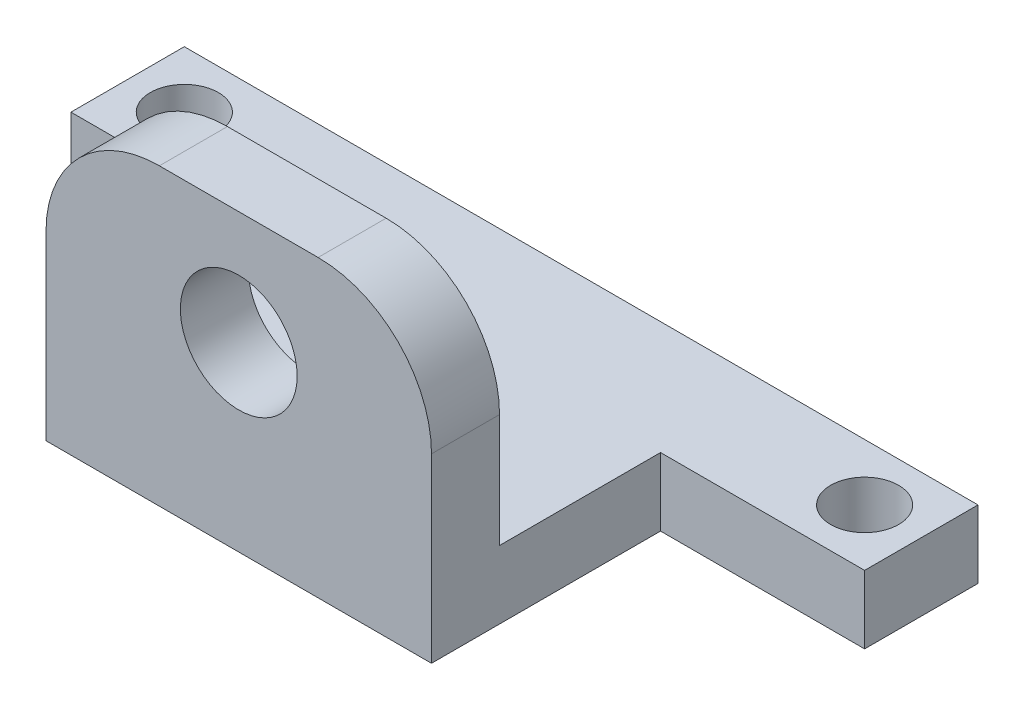
from build123d import *

# Parameters (mm, degrees)
BOSS_EXTRUDE1_DEPTH       = 17
F_5_0MM_DOWEL_HOLE1_D     = 5.15
F_5_0MM_DOWEL_HOLE1_DEPTH = 3
F_5_0MM_DOWEL_HOLE1_TIP   = 1.547216094
FILLET1_R                 = 5
M3_CLEARANCE_HOLE1_D      = 3.6
SKETCH6_W                 = 9
SKETCH6_H                 = 5
SKETCH6_R                 = 1.5
BOSS_EXTRUDE2_DEPTH       = 3
SKETCH7_W                 = 17
SKETCH7_H                 = 16
CUT_EXTRUDE1_DEPTH        = 3


with BuildPart() as part:
    # Sketch1 → Boss-Extrude1 (new body)
    with BuildSketch(Plane(origin=(0, 0, 0), x_dir=(0, 0, -1), z_dir=(1, 0, 0))):
        Polygon((0, 0), (31.1, 0), (31.1, 3), (3, 3), (3, 13), (0, 13), align=None)
    extrude(amount=BOSS_EXTRUDE1_DEPTH)

    # Ø5.0mm Dowel Hole1
    with Locations(Plane.XY):
        with Locations((8.5, 8)):
            Hole(F_5_0MM_DOWEL_HOLE1_D / 2, depth=F_5_0MM_DOWEL_HOLE1_DEPTH)
            with Locations((0, 0, -(F_5_0MM_DOWEL_HOLE1_DEPTH + F_5_0MM_DOWEL_HOLE1_TIP / 2))):  # 118° drill point
                Cone(0, F_5_0MM_DOWEL_HOLE1_D / 2, F_5_0MM_DOWEL_HOLE1_TIP, mode=Mode.SUBTRACT)

    # Fillet1
    fillet1_edges = [part.edges().sort_by_distance(p)[0] for p in [
        (0, 13, -1.5),
        (17, 13, -1.5),
    ]]
    fillet(fillet1_edges, radius=FILLET1_R)

    # M3 Clearance Hole1 (through all)
    with Locations(Plane(origin=(0, 3, 0), x_dir=(1, 0, 0), z_dir=(0, 1, 0))):
        with Locations((13.5, 27.6), (3.5, 27.6), (3.5, 17.6), (13.5, 17.6)):
            Hole(M3_CLEARANCE_HOLE1_D / 2)

    # Sketch6 → Boss-Extrude2 (add)
    with BuildSketch(Plane.XZ):
        with Locations((-4.5, -12.6)):
            Rectangle(SKETCH6_W, SKETCH6_H)
        with Locations((-6.5, -12.6)):
            Circle(SKETCH6_R, mode=Mode.SUBTRACT)
    boss_extrude2 = extrude(amount=-BOSS_EXTRUDE2_DEPTH)

    # Mirror1: Boss-Extrude2 across plane
    add(boss_extrude2.mirror(Plane.ZY.offset(-8.5)))

    # Sketch7 → Cut-Extrude1 (cut)
    with BuildSketch(Plane(origin=(0, 3, 0), x_dir=(1, 0, 0), z_dir=(0, 1, 0))):
        with Locations((8.5, 23.1)):
            Rectangle(SKETCH7_W, SKETCH7_H)
    extrude(amount=-CUT_EXTRUDE1_DEPTH, mode=Mode.SUBTRACT)


solid = part.part
